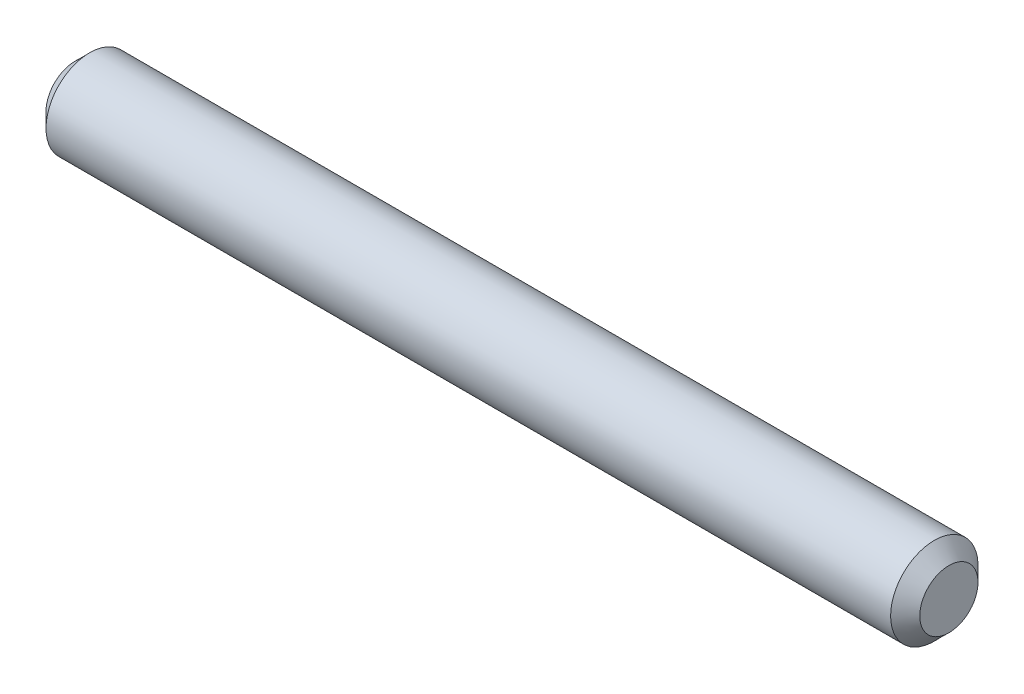
from build123d import *


with BuildPart() as part:
    # Sketch1 → Revolve1 (revolve)
    with BuildSketch(Plane.XY):
        Polygon((1.5, 0), (1.5, 1), (2, 1.5), (31, 1.5), (31.5, 1), (31.5, 0), align=None)
    revolve(axis=Axis((0, 0, 0), (1, 0, 0)))


solid = part.part
